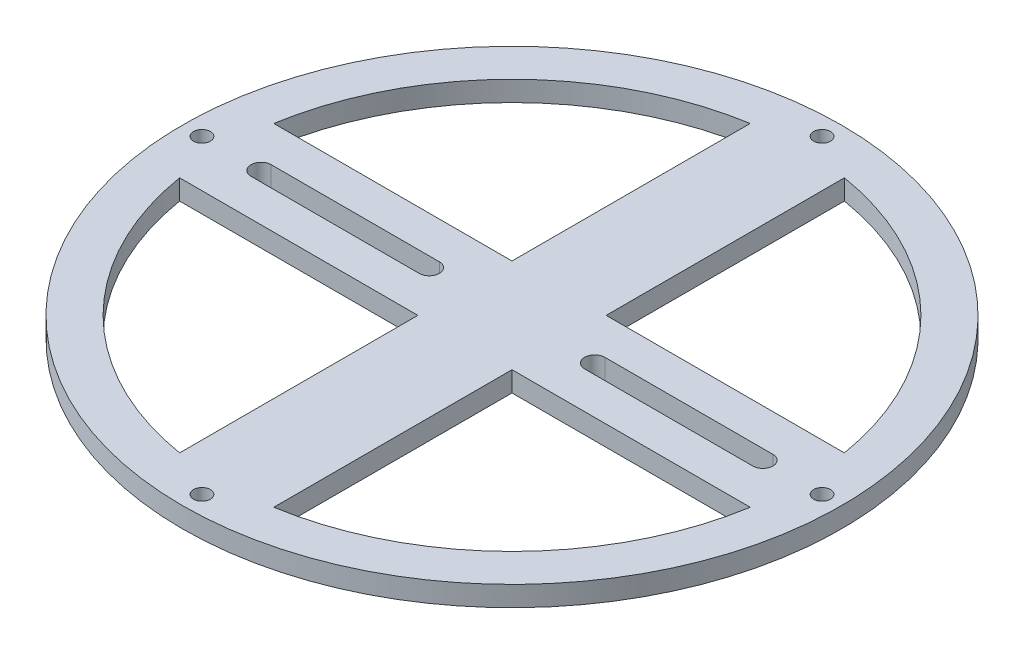
from build123d import *

# Parameters (mm, degrees)
SKETCH_1_R               = 49
EXTRUDE_1_DEPTH          = 3
CUT_EXTRUDE_3_DEPTH      = 70.361372535
CUT_EXTRUDE_4_DEPTH      = 70.361372535
PATTERN_CIRCULAR_4_COUNT = 2
SKETCH_2_R               = 1.25
CUT_EXTRUDE_5_DEPTH      = 70.361372535
PATTERN_CIRCULAR_5_COUNT = 4
PATTERN_CIRCULAR_6_COUNT = 4


with BuildPart() as part:
    # 草图1 → 凸台-拉伸1 (new body)
    with BuildSketch(Plane(origin=(0, 0, 0), x_dir=(1, 0, 0), z_dir=(0, 1, 0))):
        Circle(SKETCH_1_R)
    extrude(amount=EXTRUDE_1_DEPTH)

    # 草图5 → 切除-拉伸3 (cut, through all)
    with BuildSketch(Plane(origin=(0, 3, 0), x_dir=(1, 0, 0), z_dir=(0, 1, 0))):
        with BuildLine():
            Line((7, 42.420036355), (7, 7))
            Line((7, 7), (42.420036355, 7))
            ThreePointArc((42.420036355, 7), (30.401147054, 30.401147054), (7, 42.420036355))
        make_face()
    cut_extrude_3 = extrude(amount=-CUT_EXTRUDE_3_DEPTH, mode=Mode.SUBTRACT)

    # 草图6 → 切除-拉伸4 (cut, through all)
    with BuildSketch(Plane(origin=(0, 3, 0), x_dir=(1, 0, 0), z_dir=(0, 1, 0))):
        with BuildLine():
            Line((-12.3, -1.5), (-37.3, -1.5))
            ThreePointArc((-37.3, -1.5), (-38.8, 0), (-37.3, 1.5))
            Line((-37.3, 1.5), (-12.3, 1.5))
            ThreePointArc((-12.3, 1.5), (-10.8, 0), (-12.3, -1.5))
        make_face()
    cut_extrude_4 = extrude(amount=-CUT_EXTRUDE_4_DEPTH, mode=Mode.SUBTRACT)

    # 阵列(圆周)4: 切除-拉伸4 ×2 about axis
    pattern_circular_4_axis = Axis((0, 3, 0), (0, -1, 0))
    for i in range(1, PATTERN_CIRCULAR_4_COUNT):
        add(cut_extrude_4.rotate(pattern_circular_4_axis, i * 360 / PATTERN_CIRCULAR_4_COUNT), mode=Mode.SUBTRACT)

    # 草图2 → 切除-拉伸5 (cut, through all)
    with BuildSketch(Plane(origin=(0, 3, 0), x_dir=(1, 0, 0), z_dir=(0, 1, 0))):
        with Locations((0, 46.1)):
            Circle(SKETCH_2_R)
    cut_extrude_5 = extrude(amount=-CUT_EXTRUDE_5_DEPTH, mode=Mode.SUBTRACT)

    # 阵列(圆周)5: 切除-拉伸5 ×4 about axis
    pattern_circular_5_axis = Axis((0, 3, 0), (0, -1, 0))
    for i in range(1, PATTERN_CIRCULAR_5_COUNT):
        add(cut_extrude_5.rotate(pattern_circular_5_axis, i * 360 / PATTERN_CIRCULAR_5_COUNT), mode=Mode.SUBTRACT)

    # 阵列(圆周)6: 切除-拉伸3 ×4 about axis
    pattern_circular_6_axis = Axis((0, 3, 0), (0, -1, 0))
    for i in range(1, PATTERN_CIRCULAR_6_COUNT):
        add(cut_extrude_3.rotate(pattern_circular_6_axis, i * 360 / PATTERN_CIRCULAR_6_COUNT), mode=Mode.SUBTRACT)


solid = part.part
